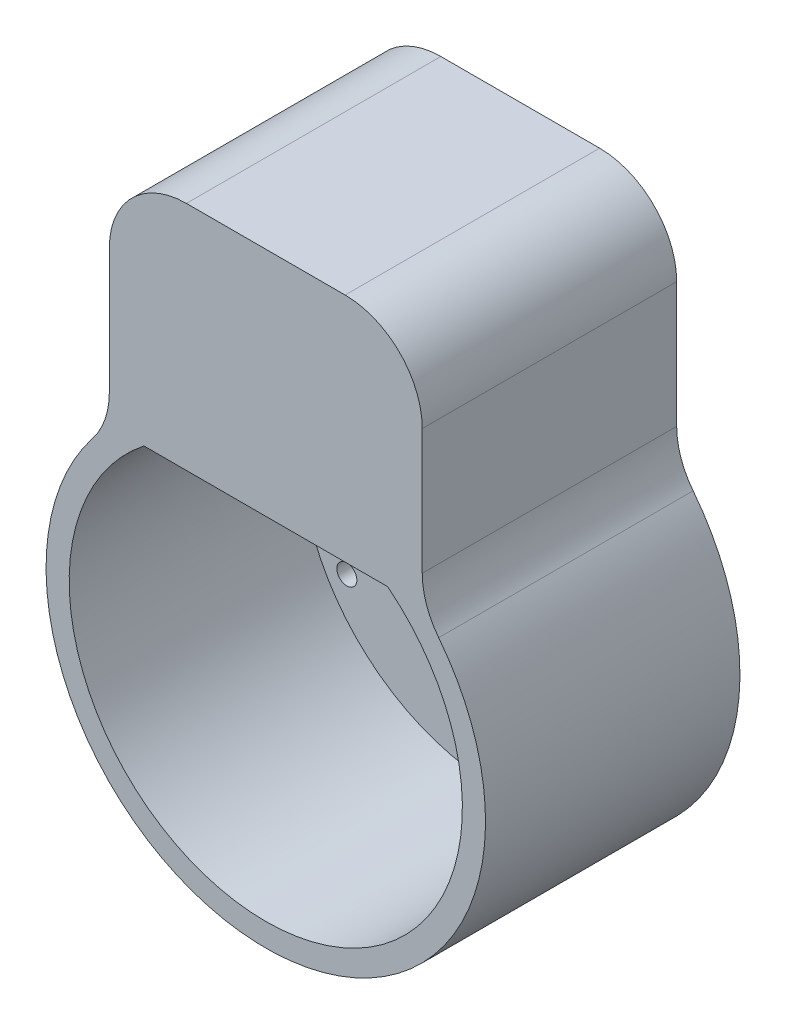
from build123d import *

# Parameters (mm, degrees)
SKETCH1_R                                       = 28.5
BOSS_EXTRUDE1_DEPTH                             = 33
SHELL1_T                                        = -3
SKETCH2_W                                       = 68.33882079
SKETCH2_H                                       = 10.979214438
CUT_EXTRUDE1_DEPTH                              = 53.091266063
SKETCH3_W                                       = 40.58739611
SKETCH3_H                                       = 33
BOSS_EXTRUDE2_DEPTH                             = 30
CUT_EXTRUDE4_REACH                              = 68.35
SKETCH6_R                                       = 1.3
CIRPATTERN1_COUNT                               = 6
FILLET1_R                                       = 10
SHELL2_START                                    = 10
SHELL2_DEPTH                                    = 13
SKETCH9_W                                       = 16.58739611
SKETCH9_H                                       = 5.010392781
CUT_EXTRUDE6_DEPTH                              = 12
CSK_FOR_M3_FLAT_HEAD_MACHINE_SCREW1_D           = 3.2
CSK_FOR_M3_FLAT_HEAD_MACHINE_SCREW1_DEPTH       = 10
CSK_FOR_M3_FLAT_HEAD_MACHINE_SCREW1_CSINK_D     = 6.3
CSK_FOR_M3_FLAT_HEAD_MACHINE_SCREW1_CSINK_ANGLE = 90
CSK_FOR_M3_FLAT_HEAD_MACHINE_SCREW1_TIP         = 0.96137699
FILLET2_R                                       = 5
FILLET3_R                                       = 5


# Read off the part's stored shape, not the designer's step: Shell2
with BuildPart() as part:
    # Sketch1 → Boss-Extrude1 (new body)
    with BuildSketch(Plane.XY):
        Circle(SKETCH1_R)
    extrude(amount=BOSS_EXTRUDE1_DEPTH)

    # Shell1
    shell1_openings = [part.faces().sort_by_distance(p)[0] for p in [
        (0, 0, 33),
    ]]
    offset(amount=SHELL1_T, openings=shell1_openings, kind=Kind.INTERSECTION)

    # Sketch2 → Cut-Extrude1 (cut, through all)
    with BuildSketch(Plane.XY.offset(33)):
        with Locations((0, 25.5)):
            Rectangle(SKETCH2_W, SKETCH2_H)
    extrude(amount=-CUT_EXTRUDE1_DEPTH, mode=Mode.SUBTRACT)

    # Sketch3 → Boss-Extrude2 (add)
    with BuildSketch(Plane(origin=(0, 20.010392781, 0), x_dir=(1, 0, 0), z_dir=(0, 1, 0))):
        with Locations((0, -16.5)):
            Rectangle(SKETCH3_W, SKETCH3_H)
    extrude(amount=BOSS_EXTRUDE2_DEPTH)

    # Sketch6 → Cut-Extrude4 (cut, up to next)
    with BuildSketch(Plane(origin=(0, 0, 0), x_dir=(-1, 0, 0), z_dir=(0, 0, -1)), mode=Mode.PRIVATE) as cut_extrude4_sk1:
        with Locations((0, -22.5)):
            Circle(SKETCH6_R)
    cut_extrude4_tool1 = extrude(cut_extrude4_sk1.sketch, amount=-CUT_EXTRUDE4_REACH, mode=Mode.PRIVATE) & part.part
    cut_extrude4 = cut_extrude4_tool1.solids().sort_by_distance((0, -22.5, 0))[0]
    add(cut_extrude4, mode=Mode.SUBTRACT)

    # CirPattern1: Cut-Extrude4 ×6 about axis, 1 skipped
    cirpattern1_axis = Axis((0, 0, 0), (0, 0, 1))
    add([cut_extrude4.rotate(cirpattern1_axis, i * 360 / CIRPATTERN1_COUNT) for i in range(1, CIRPATTERN1_COUNT) if i not in (3,)], mode=Mode.SUBTRACT)

    # Fillet1
    fillet1_edges = [part.edges().sort_by_distance(p)[0] for p in [
        (-20.293698055, 20.010392781, 16.5),
        (20.293698055, 20.010392781, 16.5),
        (-20.293698055, 50.010392781, 16.5),
        (20.293698055, 50.010392781, 16.5),
    ]]
    fillet(fillet1_edges, radius=FILLET1_R)

    # Shell2 outline → Shell2 (cut)
    with BuildSketch(Plane.XY.offset(SHELL2_START)):
        with BuildLine():
            Line((-10.293698055, 40.010392781), (-10.293698055, 23.760089607))
            ThreePointArc((-10.293698055, 23.760089607), (-10.382557976, 21.876874075), (-10.648348129, 20.010392781))
            Line((-10.648348129, 20.010392781), (10.648348129, 20.010392781))
            ThreePointArc((10.648348129, 20.010392781), (10.382557976, 21.876874075), (10.293698055, 23.760089607))
            Line((10.293698055, 23.760089607), (10.293698055, 40.010392781))
            Line((10.293698055, 40.010392781), (-10.293698055, 40.010392781))
        make_face()
    extrude(amount=SHELL2_DEPTH, mode=Mode.SUBTRACT)

    # Sketch9 → Cut-Extrude6 (cut)
    with BuildSketch(Plane(origin=(0, 0, 0), x_dir=(-1, 0, 0), z_dir=(0, 0, -1))):
        with Locations((0, 32.505196391)):
            Rectangle(SKETCH9_W, SKETCH9_H)
    extrude(amount=-CUT_EXTRUDE6_DEPTH, mode=Mode.SUBTRACT)

    # CSK for M3 Flat Head Machine Screw1
    with Locations(Plane(origin=(0, 0, 0), x_dir=(-1, 0, 0), z_dir=(0, 0, -1))):
        with Locations((-14, 43.010392781), (-14, 29.010392781), (14, 43.010392781), (14, 36.010392781), (14, 29.010392781), (-14, 36.010392781)):
            CounterSinkHole(CSK_FOR_M3_FLAT_HEAD_MACHINE_SCREW1_D / 2, CSK_FOR_M3_FLAT_HEAD_MACHINE_SCREW1_CSINK_D / 2, depth=CSK_FOR_M3_FLAT_HEAD_MACHINE_SCREW1_DEPTH, counter_sink_angle=CSK_FOR_M3_FLAT_HEAD_MACHINE_SCREW1_CSINK_ANGLE)
            with Locations((0, 0, -(CSK_FOR_M3_FLAT_HEAD_MACHINE_SCREW1_DEPTH + CSK_FOR_M3_FLAT_HEAD_MACHINE_SCREW1_TIP / 2))):  # 118° drill point
                Cone(0, CSK_FOR_M3_FLAT_HEAD_MACHINE_SCREW1_D / 2, CSK_FOR_M3_FLAT_HEAD_MACHINE_SCREW1_TIP, mode=Mode.SUBTRACT)

    # Fillet2
    fillet2_edges = [part.edges().sort_by_distance(p)[0] for p in [
        (0, 20.010392781, 23),
        (0, 20.010392781, 10),
        (10.648348129, 20.010392781, 16.5),
        (-10.648348129, 20.010392781, 16.5),
    ]]
    fillet(fillet2_edges, radius=FILLET2_R)

    # Fillet3
    # the kernel refuses this fillet: 5 mm, written as the material it takes off along each edge
    with BuildSketch(Plane(origin=(-8.293698055, 30, 10), x_dir=(0, -1, 0), z_dir=(1, 0, 0))) as fillet3_piece_1:
        with BuildLine():
            CenterArc((FILLET3_R, FILLET3_R), FILLET3_R, 180, 90)
            Line((0, FILLET3_R), (0, 0))
            Line((0, 0), (FILLET3_R, 0))
        make_face()
    extrude(amount=16.58739611, mode=Mode.SUBTRACT)


solid = part.part
